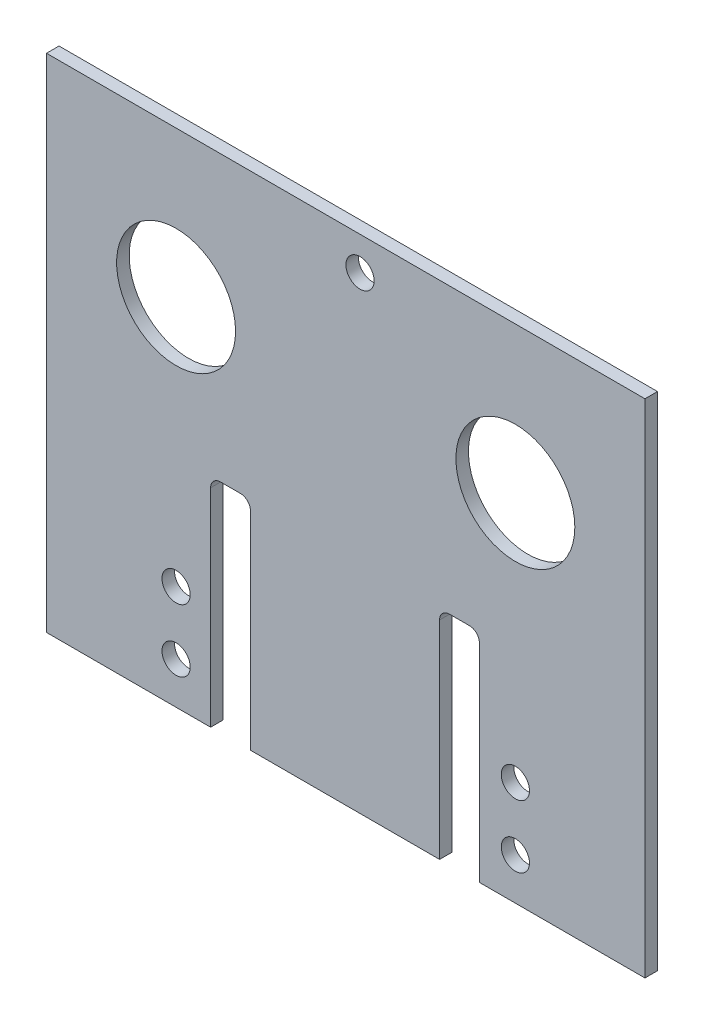
from build123d import *

# Parameters (mm, degrees)
SKETCH1_W           = 143.16
SKETCH1_H           = 120
BOSS_EXTRUDE1_DEPTH = 3
SKETCH2_R           = 14.225
SKETCH2_R_2         = 3.375
CUT_EXTRUDE1_DEPTH  = 187.825548574
SKETCH3_W           = 9.53
SKETCH3_H           = 52
SKETCH3_W_2         = 9.525
CUT_EXTRUDE2_DEPTH  = 187.825548574
FILLET2_R           = 2.38125


with BuildPart() as part:
    # Sketch1 → Boss-Extrude1 (new body)
    with BuildSketch(Plane.XY):
        with Locations((71.58, -60)):
            Rectangle(SKETCH1_W, SKETCH1_H)
    extrude(amount=BOSS_EXTRUDE1_DEPTH)

    # Sketch2 → Cut-Extrude1 (cut, through all)
    with BuildSketch(Plane.XY.offset(3)):
        with Locations((31, -35)):
            Circle(SKETCH2_R)
        with Locations((112.16, -35)):
            Circle(SKETCH2_R)
        with Locations((31, -110)):
            Circle(SKETCH2_R_2)
        with Locations((112.16, -110)):
            Circle(SKETCH2_R_2)
        with Locations((75, -8)):
            Circle(SKETCH2_R_2)
        with Locations((31, -95)):
            Circle(SKETCH2_R_2)
        with Locations((112.16, -95)):
            Circle(SKETCH2_R_2)
    extrude(amount=-CUT_EXTRUDE1_DEPTH, mode=Mode.SUBTRACT)

    # Sketch3 → Cut-Extrude2 (cut, through all)
    with BuildSketch(Plane(origin=(0, 0, 0), x_dir=(-1, 0, 0), z_dir=(0, 0, -1))):
        with Locations((-44.022687833, -94)):
            Rectangle(SKETCH3_W, SKETCH3_H)
        with Locations((-98.796653089, -94)):
            Rectangle(SKETCH3_W_2, SKETCH3_H)
    extrude(amount=-CUT_EXTRUDE2_DEPTH, mode=Mode.SUBTRACT)

    # Fillet2
    fillet2_edges = [part.edges().sort_by_distance(p)[0] for p in [
        (39.257687833, -68, 1.5),
        (48.787687833, -68, 1.5),
        (103.559153089, -68, 1.5),
        (94.034153089, -68, 1.5),
    ]]
    fillet(fillet2_edges, radius=FILLET2_R)


solid = part.part
